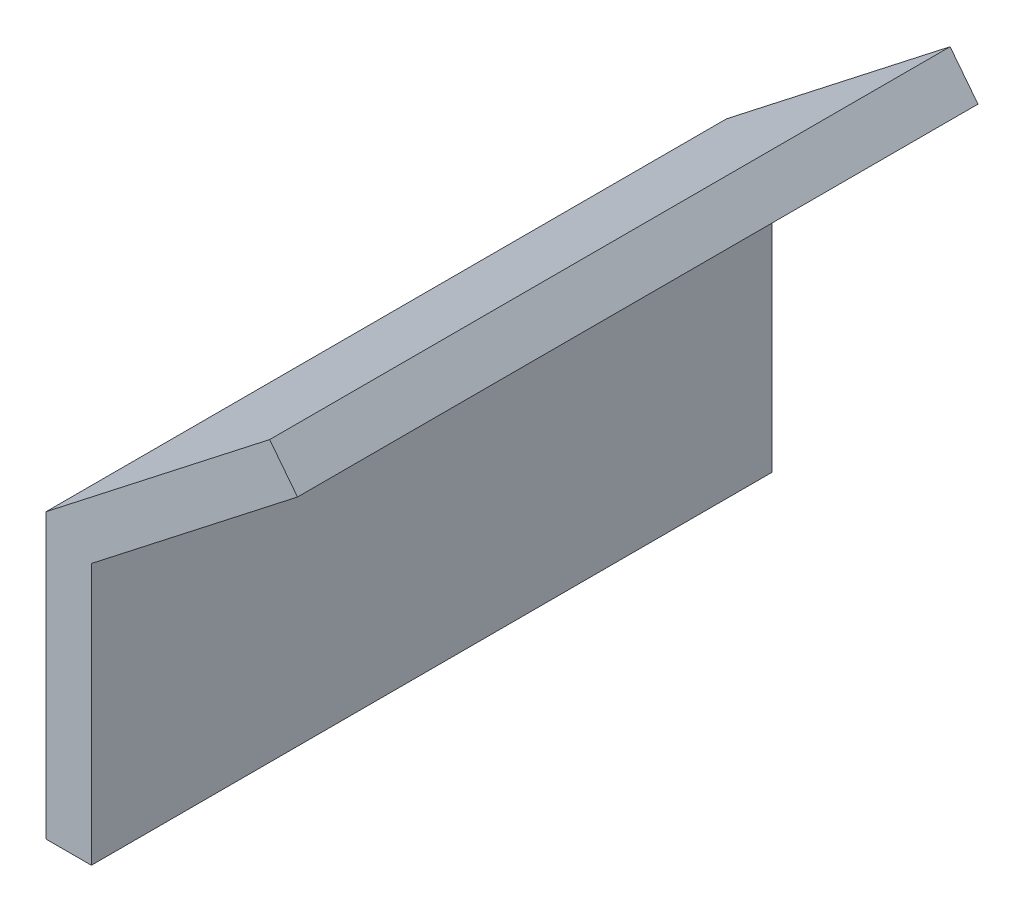
from build123d import *

# Parameters (mm, degrees)
BOSS_EXTRUDE1_DEPTH = 60


with BuildPart() as part:
    # Sketch1 → Boss-Extrude1 (new, symmetric)
    with BuildSketch(Plane.XY):
        Polygon((0, 0), (39.438116885, 30.734913967), (44.35570312, 24.424815265), (8, -3.90791195), (8, -50), (0, -50), align=None)
    extrude(amount=BOSS_EXTRUDE1_DEPTH, both=True)


solid = part.part
